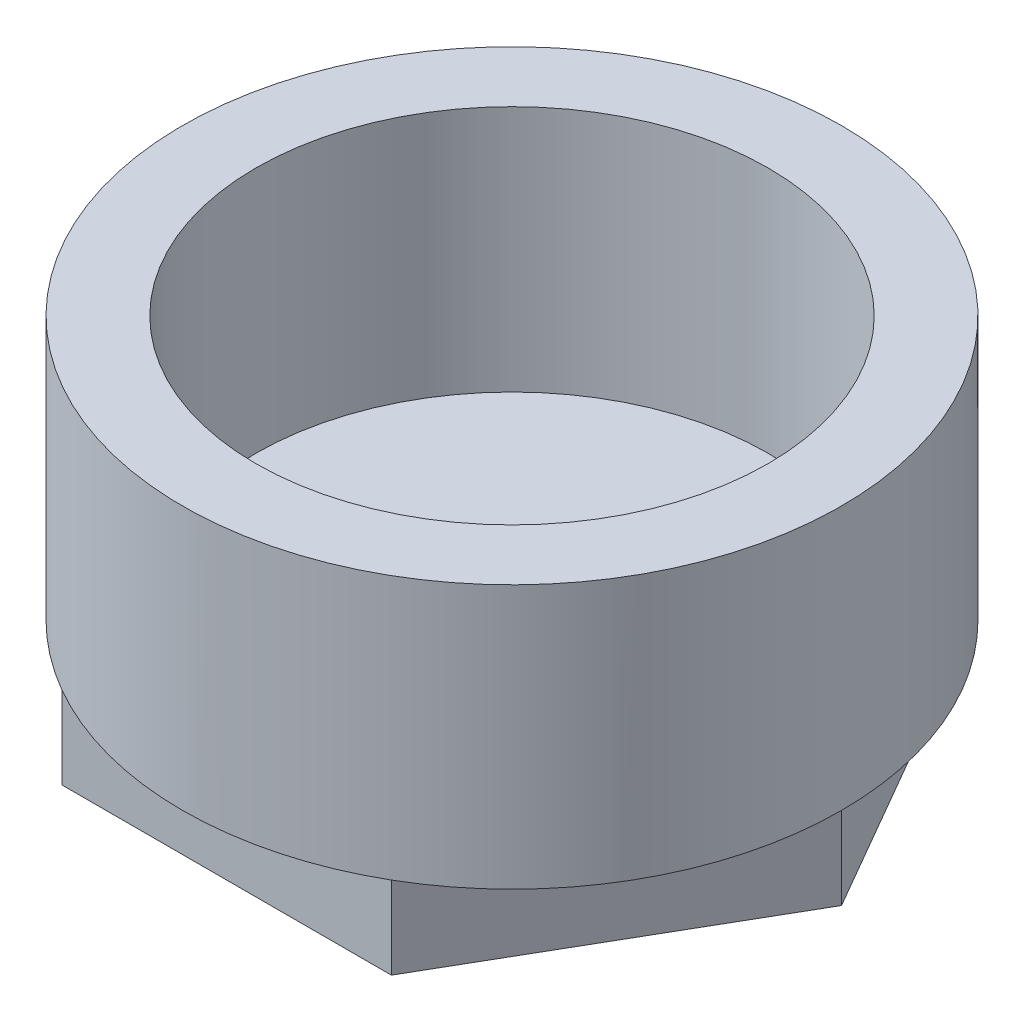
from build123d import *

# Parameters (mm, degrees)
SCHIZZO2_R               = 3.175
TAGLIO_ESTRUSIONE1_DEPTH = 10
TAGLIO_ESTRUSIONE2_START = -5
TAGLIO_ESTRUSIONE2_DEPTH = 5


with BuildPart() as part:
    # Schizzo1 → Rivoluzione1 (revolve)
    with BuildSketch(Plane.XY):
        Polygon((0, 0), (-20, 0), (-20, 21), (-15.5465, 21), (-15.5465, 6), (0, 6), align=None)
    revolve(axis=Axis((0, 0, 0), (0, 1, 0)))

    # Schizzo2 → Taglio-Estrusione1 (cut)
    with BuildSketch(Plane.XZ):
        Circle(SCHIZZO2_R)
    extrude(amount=-TAGLIO_ESTRUSIONE1_DEPTH, mode=Mode.SUBTRACT)

    # Schizzo5 → Taglio-Estrusione2 (cut)
    with BuildSketch(Plane(origin=(0, 0, 0), x_dir=(-1, 0, 0), z_dir=(0, -1, 0)).offset(TAGLIO_ESTRUSIONE2_START)):
        with BuildLine():
            ThreePointArc((20, 0), (17.320508076, 10), (10, 17.320508076))
            Line((10, 17.320508076), (20, 0))
        make_face()
        with BuildLine():
            Line((-10, 17.320508076), (10, 17.320508076))
            ThreePointArc((10, 17.320508076), (0, 20), (-10, 17.320508076))
        make_face()
        with BuildLine():
            ThreePointArc((10, -17.320508076), (17.320508076, -10), (20, 0))
            Line((20, 0), (10, -17.320508076))
        make_face()
        with BuildLine():
            Line((-20, 0), (-10, 17.320508076))
            ThreePointArc((-10, 17.320508076), (-17.320508076, 10), (-20, 0))
        make_face()
        with BuildLine():
            ThreePointArc((-10, -17.320508076), (0, -20), (10, -17.320508076))
            Line((10, -17.320508076), (-10, -17.320508076))
        make_face()
        with BuildLine():
            Line((-10, -17.320508076), (-20, 0))
            ThreePointArc((-20, 0), (-17.320508076, -10), (-10, -17.320508076))
        make_face()
    extrude(amount=TAGLIO_ESTRUSIONE2_DEPTH, mode=Mode.SUBTRACT)


solid = part.part
